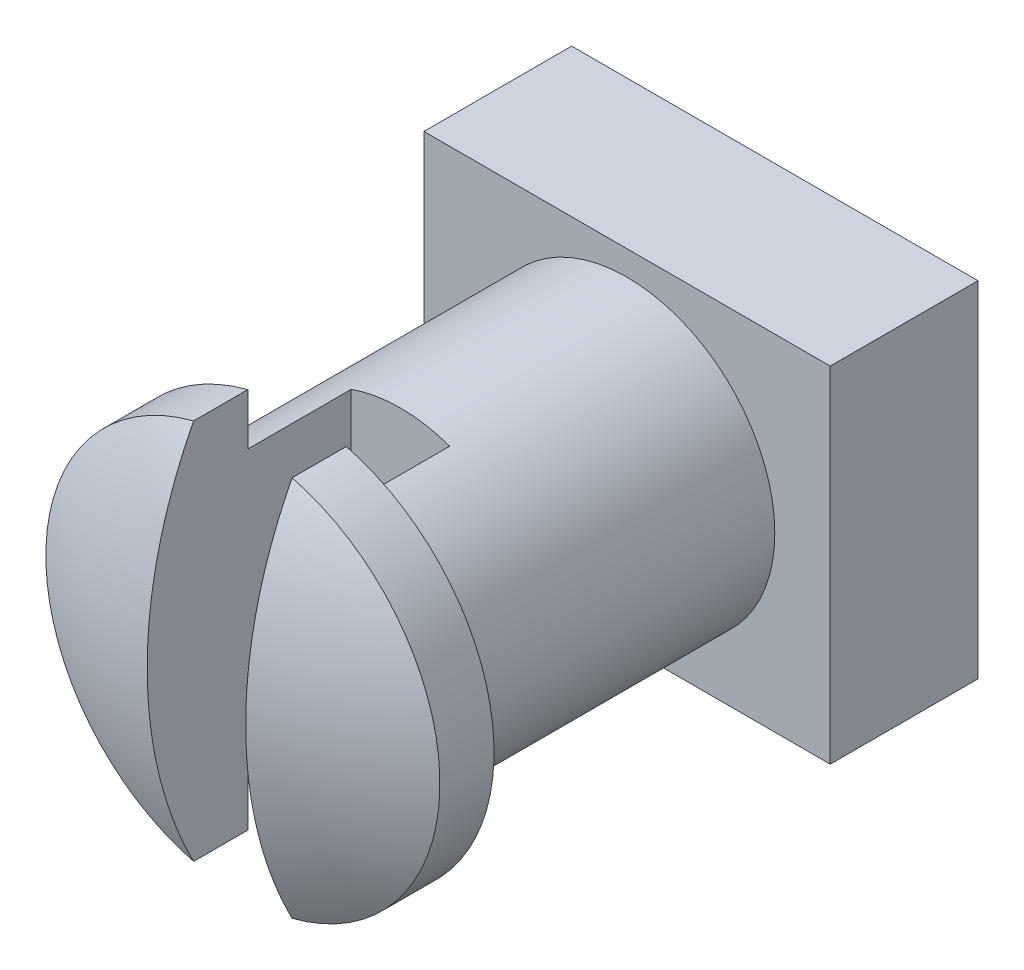
from build123d import *

# Parameters (mm, degrees)
SKETCH1_W               = 10.4775
SKETCH1_H               = 8.89
BOSS_EXTRUDE1_DEPTH     = 3.81
SKETCH2_R               = 3.81
BOSS_EXTRUDE2_DEPTH     = 9.906
SKETCH3_R               = 5.08
BOSS_EXTRUDE3_DEPTH     = 1.397
CUT_EXTRUDE1_DEPTH      = 17.668266183
CUT_EXTRUDE1_DEPTH_BACK = 17.668266183
SKETCH4_W               = 2.54
SKETCH4_H               = 5.334


# Read off the part's stored shape, not the designer's step: Dome1
with BuildPart() as part:
    # Sketch1 → Boss-Extrude1 (new body)
    with BuildSketch(Plane.XY):
        Rectangle(SKETCH1_W, SKETCH1_H)
    extrude(amount=BOSS_EXTRUDE1_DEPTH)


with BuildPart() as body_2:
    # Sketch2 → Boss-Extrude2 (new body)
    with BuildSketch(Plane.XY.offset(3.81)):
        Circle(SKETCH2_R)
    extrude(amount=BOSS_EXTRUDE2_DEPTH)

    # Sketch3 → Boss-Extrude3 (add)
    with BuildSketch(Plane.XY.offset(13.716)):
        Circle(SKETCH3_R)
    extrude(amount=-BOSS_EXTRUDE3_DEPTH)

    # Dome1 outline → Dome1 (revolve)
    with BuildSketch(Plane.XZ):
        with BuildLine():
            Line((0, 13.716), (5.08000001, 13.715999995))
            ThreePointArc((5.08000001, 13.715999995), (2.618172078, 14.663688288), (0, 14.986))
            Line((0, 14.986), (0, 13.716))
        make_face()
    revolve(axis=Axis((0, 0, 0), (0, 0, 1)))

    # Sketch4 → Cut-Extrude1 (cut, two sides: drawn at the far end of the back side and taken through both)
    with BuildSketch(Plane(origin=(0, 0, 0), x_dir=(1, 0, 0), z_dir=(0, 1, 0)).offset(-CUT_EXTRUDE1_DEPTH_BACK)):
        with Locations((0, -12.319)):
            Rectangle(SKETCH4_W, SKETCH4_H)
    extrude(amount=CUT_EXTRUDE1_DEPTH + CUT_EXTRUDE1_DEPTH_BACK, mode=Mode.SUBTRACT)


solid = Compound([part.part, body_2.part])
